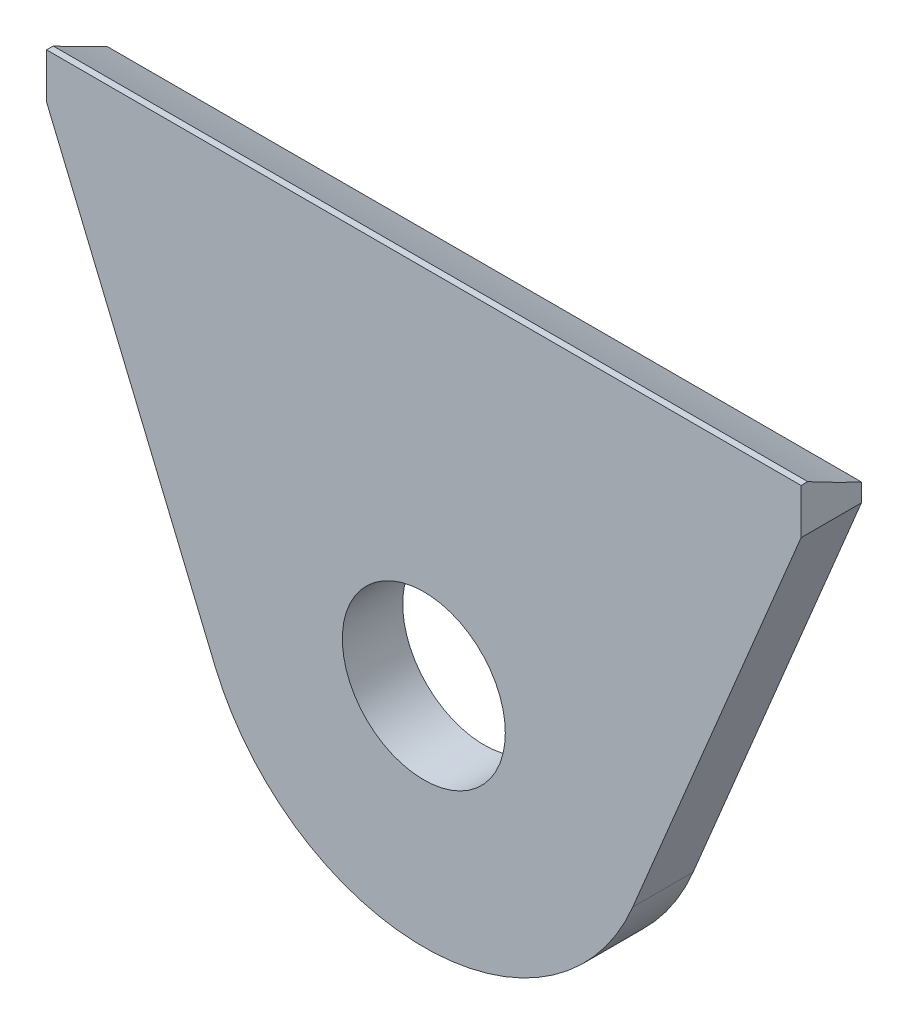
from build123d import *

# Parameters (mm, degrees)
SKETCH_1_R                 = 5.4
EXTRUDE_1_DEPTH            = 4
CUT_EXTRUDE_533_DEPTH      = 35.885527085
CUT_EXTRUDE_533_DEPTH_BACK = 35.885527085
SKETCH_513_R               = 70.5


with BuildPart() as part:
    # Эскиз1 → Бобышка-Вытянуть1 (new body)
    with BuildSketch(Plane.XY):
        with BuildLine():
            Line((-25, 24), (25, 24))
            Line((25, 24), (25, 21))
            Line((25, 21), (13.846153846, -5.769230769))
            ThreePointArc((13.846153846, -5.769230769), (0, -15), (-13.846153846, -5.769230769))
            Line((-13.846153846, -5.769230769), (-25, 21))
            Line((-25, 21), (-25, 24))
        make_face()
        Circle(SKETCH_1_R, mode=Mode.SUBTRACT)
    extrude(amount=EXTRUDE_1_DEPTH)

    # Sketch 513 → Cut-Extrude 533 (cut, two sides: drawn at the far end of the back side and taken through both)
    with BuildSketch(Plane(origin=(0, 0, 0), x_dir=(0, 0, -1), z_dir=(1, 0, 0)).offset(-CUT_EXTRUDE_533_DEPTH_BACK)):
        with Locations((30, 86)):
            Circle(SKETCH_513_R)
    extrude(amount=CUT_EXTRUDE_533_DEPTH + CUT_EXTRUDE_533_DEPTH_BACK, mode=Mode.SUBTRACT)


solid = part.part
